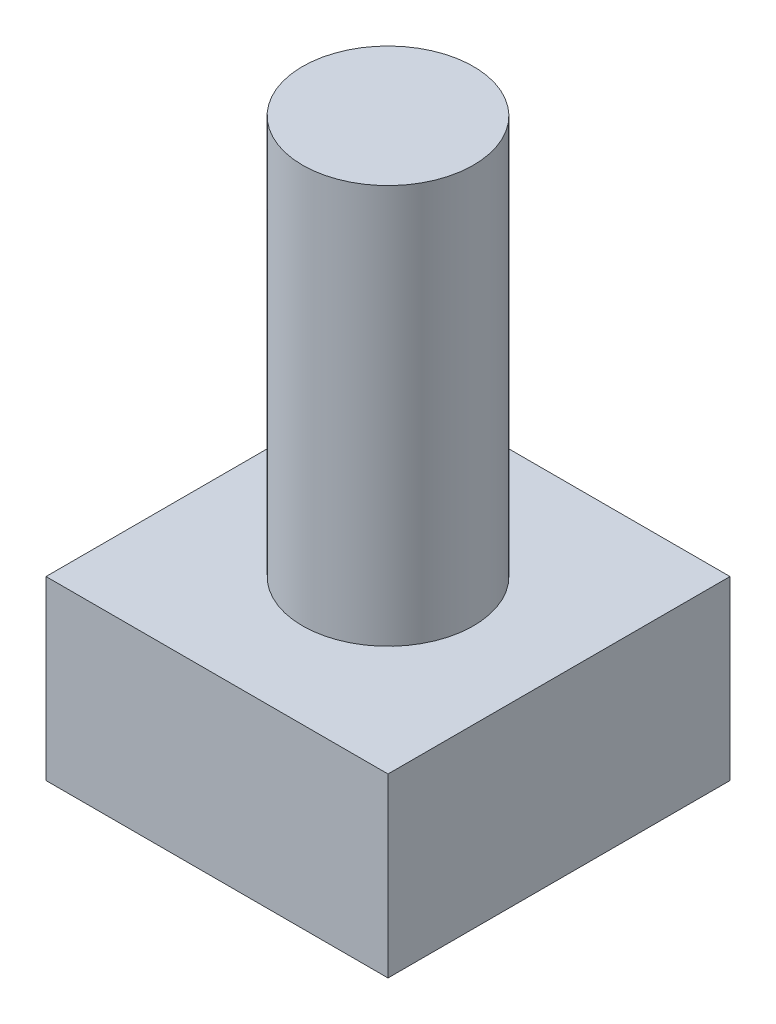
from build123d import *

# Parameters (mm, degrees)
SKETCH_1_W      = 6
SKETCH_1_H      = 6
EXTRUDE_1_DEPTH = 3.1
SKETCH_2_R      = 1.5
EXTRUDE_2_DEPTH = 7


with BuildPart() as part:
    # 草图1 → 拉伸1 (new body)
    with BuildSketch(Plane(origin=(0, 0, 0), x_dir=(1, 0, 0), z_dir=(0, 1, 0))):
        Rectangle(SKETCH_1_W, SKETCH_1_H)
    extrude(amount=EXTRUDE_1_DEPTH)

    # 草图2 → 拉伸2 (add)
    with BuildSketch(Plane(origin=(0, 3.1, 0), x_dir=(-1, 0, 0), z_dir=(0, 1, 0))):
        Circle(SKETCH_2_R)
    extrude(amount=EXTRUDE_2_DEPTH)


solid = part.part
